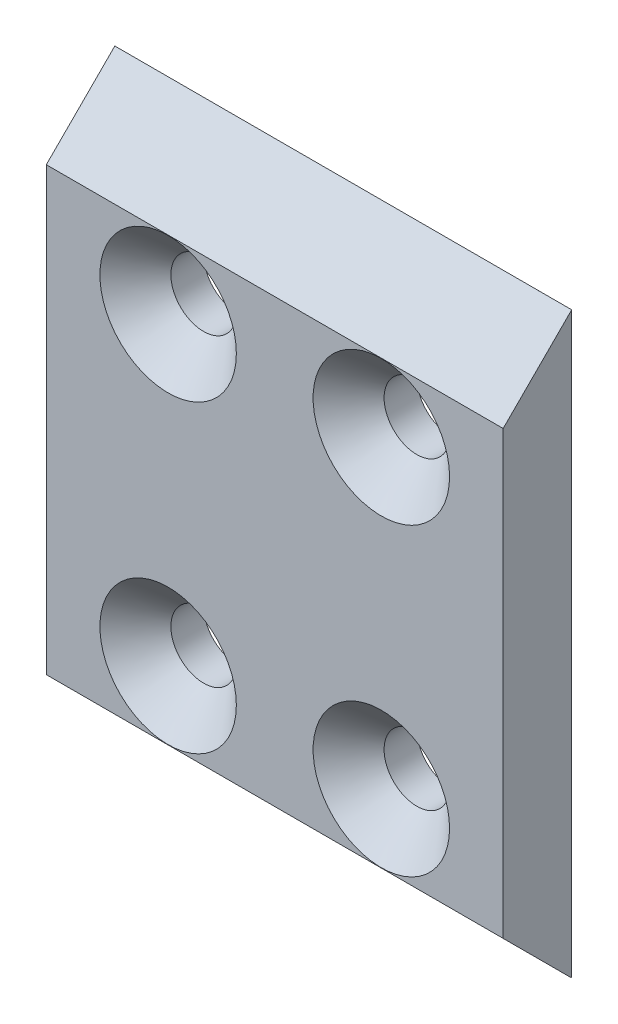
from build123d import *

# Parameters (mm, degrees)
SKETCH_1_W                   = 30
SKETCH_1_H                   = 38
EXTRUDE_1_DEPTH              = 4.5
CHAMFER_1_SIZE               = 4.5
HOLE_WIZARD_M4_1_D           = 4.3
HOLE_WIZARD_M4_1_CSINK_D     = 8.96
HOLE_WIZARD_M4_1_CSINK_ANGLE = 90


with BuildPart() as part:
    # 草图1 → 凸台-拉伸1 (new body)
    with BuildSketch(Plane.XY):
        with Locations((15, 19)):
            Rectangle(SKETCH_1_W, SKETCH_1_H)
    extrude(amount=EXTRUDE_1_DEPTH)

    # 倒角1
    chamfer_1_edges = [part.edges().sort_by_distance(p)[0] for p in [
        (15, 0, 4.5),
        (15, 38, 4.5),
    ]]
    chamfer(chamfer_1_edges, length=CHAMFER_1_SIZE - 0.0001)  # a hair under: the kernel refuses the full size

    # M4 六角凹锥坑螺钉的锥形沉头孔1 (through all)
    with Locations(Plane.XY.offset(4.5)):
        with Locations((8, 9), (8, 29), (22, 29), (22, 9)):
            CounterSinkHole(HOLE_WIZARD_M4_1_D / 2, HOLE_WIZARD_M4_1_CSINK_D / 2, counter_sink_angle=HOLE_WIZARD_M4_1_CSINK_ANGLE)


solid = part.part
